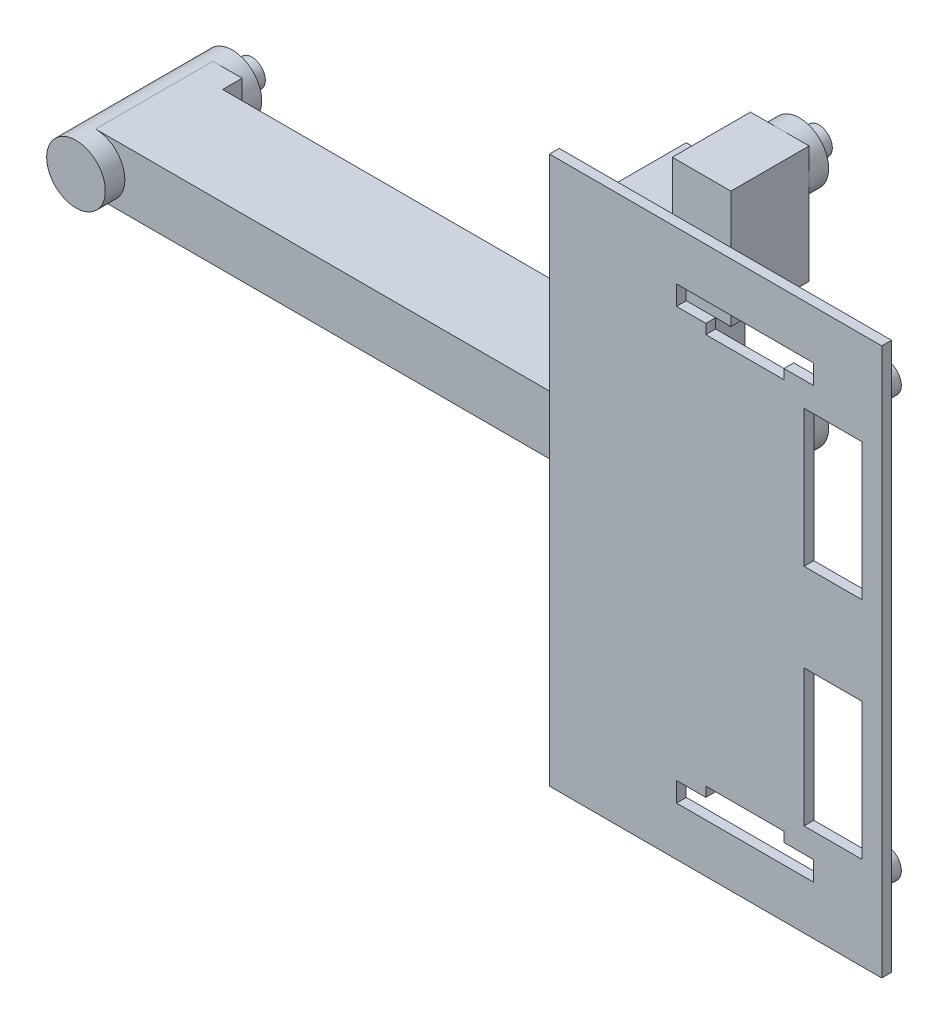
from build123d import *

# Parameters (mm, degrees)
SKETCH_1_W            = 65
SKETCH_1_H            = 6
EXTRUDE_1_DEPTH       = 12
FILLET_4_R            = 3
FILLET_5_R            = 3
SKETCH_7_R            = 1.375
EXTRUDE_2_DEPTH       = 4
SKETCH_8_R            = 3
EXTRUDE_3_DEPTH       = 2
EXTRUDE_START         = 4
SKETCH_9_R            = 3
EXTRUDE_4_DEPTH       = 4
SKETCH_10_R           = 3
EXTRUDE_5_DEPTH       = 2
SKETCH_11_R           = 1.375
EXTRUDE_6_DEPTH       = 2
SKETCH_12_W           = 6
SKETCH_12_H           = 6
EXTRUDE_7_DEPTH       = 2
SKETCH_13_W           = 6
SKETCH_13_H           = 30
EXTRUDE_8_DEPTH       = 2
SKETCH_14_R           = 3
EXTRUDE_9_DEPTH       = 2
SKETCH_15_R           = 1.375
EXTRUDE_10_DEPTH      = 4
SKETCH_18_W           = 6
SKETCH_18_H           = 30
EXTRUDE_11_DEPTH      = 4
SKETCH_19_W           = 6
SKETCH_19_H           = 30
EXTRUDE_12_DEPTH      = 10
SKETCH_29_W           = 68.740273107
SKETCH_29_H           = 36.698484322
CUT_EXTRUDE_3_DEPTH   = 2
SKETCH_30_W           = 7.57
SKETCH_30_H           = 6
CUT_EXTRUDE_4_DEPTH   = 12
SKETCH_31_W           = 7.57
SKETCH_31_H           = 24
EXTRUDE_18_DEPTH      = 2
SKETCH_32_W           = 6
SKETCH_32_H           = 18
CUT_EXTRUDE_6_DEPTH   = 2
SKETCH_33_W           = 1.57
SKETCH_33_H           = 18
CUT_EXTRUDE_7_DEPTH   = 2
SKETCH_34_W           = 34
SKETCH_34_H           = 50
EXTRUDE_19_DEPTH      = 1
SKETCH_35_R           = 1.5
EXTRUDE_20_DEPTH      = 2
SKETCH_36_W           = 18
SKETCH_36_H           = 4
CUT_EXTRUDE_8_DEPTH   = 3
SKETCH_37_W           = 18
SKETCH_37_H           = 4
CUT_EXTRUDE_9_DEPTH   = 3
SKETCH_38_W           = 7.949608938
SKETCH_38_H           = 37
CUT_EXTRUDE_10_DEPTH  = 3
SKETCH_39_W           = 2
SKETCH_39_H           = 38.777384981
EXTRUDE_21_DEPTH      = 1
SKETCH_40_W           = 19.891420203
SKETCH_40_H           = 2
EXTRUDE_22_DEPTH      = 1
SKETCH_41_W           = 18
SKETCH_41_H           = 2
EXTRUDE_23_DEPTH      = 1
SKETCH_42_W           = 5.949608938
SKETCH_42_H           = 7.78599904
EXTRUDE_24_DEPTH      = 1
SKETCH_43_W           = 2
SKETCH_43_H           = 2
EXTRUDE_25_DEPTH      = 1
SKETCH_44_W           = 34
SKETCH_44_H           = 6
EXTRUDE_26_DEPTH      = 1
SKETCH_45_W           = 5.949608938
SKETCH_45_H           = 1.150209715
SKETCH_45_H_2         = 0.063791245
EXTRUDE_27_DEPTH      = 1
SKETCH_46_W           = 7
SKETCH_46_H           = 1
CUT_EXTRUDE_11_DEPTH  = 11
SKETCH_47_W           = 5
SKETCH_47_H           = 6
EXTRUDE_28_DEPTH      = 7
SKETCH_48_W           = 7.57
SKETCH_48_H           = 6
EXTRUDE_29_DEPTH      = 2
SKETCH_50_W           = 26.677609113
SKETCH_50_H           = 51.423807613
EXTRUDE_35_DEPTH      = 1
SKETCH_53_W           = 28.548663147
SKETCH_53_H           = 51.906660266
CUT_EXTRUDE_21_DEPTH  = 2
SKETCH_52_R           = 1.5
EXTRUDE_37_DEPTH      = 2
SKETCH_49_W           = 5.949608938
SKETCH_49_H           = 14
CUT_EXTRUDE_22_DEPTH  = 4
SKETCH_55_W           = 2
SKETCH_55_H           = 29.414250284
EXTRUDE_40_DEPTH      = 4
SKETCH_58_W           = 25.591190643
SKETCH_58_H           = 50.94095496
CUT_EXTRUDE_23_DEPTH  = 4
SKETCH_57_R           = 1.5
EXTRUDE_41_DEPTH      = 2
SKETCH_60_W           = 26.134399878
SKETCH_60_H           = 52.268799757
EXTRUDE_43_DEPTH      = 1
SKETCH_59_W           = 5.949608938
SKETCH_59_H           = 14
CUT_EXTRUDE_24_DEPTH  = 1
SKETCH_64_W           = 54.796032673
SKETCH_64_H           = 10.19721688
CUT_EXTRUDE_25_DEPTH  = 43
SKETCH_62_R           = 3
EXTRUDE_44_DEPTH      = 2
SKETCH_63_R           = 3
EXTRUDE_45_DEPTH      = 2
SKETCH_65_R           = 1.375
EXTRUDE_46_DEPTH      = 2
SKETCH_66_W           = 1
SKETCH_66_H           = 30
CUT_EXTRUDE_26_DEPTH  = 5
SKETCH_68_W           = 6.57
SKETCH_68_H           = 9
EXTRUDE_47_DEPTH      = 12
SKETCH_67_W           = 6.57
SKETCH_67_H           = 6
CUT_EXTRUDE_29_DEPTH  = 13
SKETCH_70_W           = 48.43
SKETCH_70_H           = 12
EXTRUDE_48_DEPTH      = 7
SKETCH_71_W           = 6.57
SKETCH_71_H           = 4
EXTRUDE_49_DEPTH      = 1
SKETCH_74_R           = 3
CUT_EXTRUDE_30_DEPTH  = 32
SKETCH_75_W           = 3.133028802
SKETCH_75_H           = 7
EXTRUDE_51_DEPTH      = 12
SKETCH_76_W           = 8.590635634
SKETCH_76_H           = 9.113505167
CUT_EXTRUDE_31_DEPTH  = 12
SKETCH_77_W           = 13
SKETCH_77_H           = 1
CUT_EXTRUDE_32_DEPTH  = 124
SKETCH_72_R           = 3
EXTRUDE_52_DEPTH      = 2
EXTRUDE_53_DEPTH      = 2
EXTRUDE_53_DEPTH_BACK = 14
SKETCH_73_R           = 3
SKETCH_78_R           = 1.375
EXTRUDE_54_DEPTH      = 2
SKETCH_79_W           = 52
SKETCH_79_H           = 6
CUT_EXTRUDE_33_DEPTH  = 2
SKETCH_80_W           = 6.57
SKETCH_80_H           = 1
EXTRUDE_55_DEPTH      = 2
SKETCH_81_W           = 8
SKETCH_81_H           = 1
CUT_EXTRUDE_34_DEPTH  = 2
SKETCH_82_W           = 6.57
SKETCH_82_H           = 1
CUT_EXTRUDE_35_DEPTH  = 45
SKETCH_83_R           = 1.5
SKETCH_83_R_2         = 1.497866477
EXTRUDE_56_DEPTH      = 1
SKETCH_84_R           = 2.738772592
CUT_EXTRUDE_36_DEPTH  = 3
SKETCH_85_R           = 1.5
EXTRUDE_57_DEPTH      = 3


with BuildPart() as part:
    # 草图1 → 凸台-拉伸1 (new body)
    with BuildSketch(Plane.XY):
        Rectangle(SKETCH_1_W, SKETCH_1_H)
    extrude(amount=EXTRUDE_1_DEPTH)

    # 圆角4
    fillet_4_edges = [part.edges().sort_by_distance(p)[0] for p in [
        (-32.5, -3, 6),
    ]]
    fillet(fillet_4_edges, radius=FILLET_4_R)

    # 圆角5
    fillet_5_edges = [part.edges().sort_by_distance(p)[0] for p in [
        (-32.5, 3, 6),
    ]]
    fillet(fillet_5_edges, radius=FILLET_5_R - 0.0001)  # a hair under: the kernel refuses the full size

    # 草图7 → 凸台-拉伸2 (add)
    with BuildSketch(Plane(origin=(0, 0, 0), x_dir=(-1, 0, 0), z_dir=(0, 0, -1))):
        with Locations((29.5, 0)):
            Circle(SKETCH_7_R)
    extrude(amount=EXTRUDE_2_DEPTH)

    # 草图8 → 凸台-拉伸3 (add)
    with BuildSketch(Plane(origin=(0, 0, 0), x_dir=(-1, 0, 0), z_dir=(0, 0, -1))):
        with Locations((29.5, 0)):
            Circle(SKETCH_8_R)
    extrude(amount=EXTRUDE_3_DEPTH)

    # 草图9 → 凸台-拉伸4 (add)
    with BuildSketch(Plane.XY.offset(12).offset(EXTRUDE_START)):
        with Locations(Location((-29.5, 0, 0), (0, 0, 180))):
            Circle(SKETCH_9_R)
    extrude(amount=-EXTRUDE_4_DEPTH)

    # 草图10 → 凸台-拉伸5 (add)
    with BuildSketch(Plane(origin=(0, 0, 0), x_dir=(-1, 0, 0), z_dir=(0, 0, -1))):
        with Locations(Location((-29.5, 0, 0), (0, 0, 180))):
            Circle(SKETCH_10_R)
    extrude(amount=EXTRUDE_5_DEPTH)

    # 草图11 → 凸台-拉伸6 (add)
    with BuildSketch(Plane(origin=(0, 0, -2), x_dir=(-1, 0, 0), z_dir=(0, 0, -1))):
        with Locations((-29.5, 0)):
            Circle(SKETCH_11_R)
    extrude(amount=EXTRUDE_6_DEPTH)

    # 草图12 → 凸台-拉伸7 (add)
    with BuildSketch(Plane.XY.offset(12)):
        with Locations((29.5, 0)):
            Rectangle(SKETCH_12_W, SKETCH_12_H)
    extrude(amount=EXTRUDE_7_DEPTH)

    # 草图13 → 凸台-拉伸8 (add)
    with BuildSketch(Plane(origin=(0, 0, 0), x_dir=(-1, 0, 0), z_dir=(0, 0, -1))):
        with Locations((-29.5, 12)):
            Rectangle(SKETCH_13_W, SKETCH_13_H)
    extrude(amount=-EXTRUDE_8_DEPTH)

    # 草图14 → 凸台-拉伸9 (add)
    with BuildSketch(Plane(origin=(0, 0, 0), x_dir=(-1, 0, 0), z_dir=(0, 0, -1))):
        with Locations((-29.5, 24)):
            Circle(SKETCH_14_R)
    extrude(amount=EXTRUDE_9_DEPTH)

    # 草图15 → 凸台-拉伸10 (add)
    with BuildSketch(Plane(origin=(0, 0, 0), x_dir=(-1, 0, 0), z_dir=(0, 0, -1))):
        with Locations((-29.5, 24)):
            Circle(SKETCH_15_R)
    extrude(amount=EXTRUDE_10_DEPTH)

    # 草图18 → 凸台-拉伸11 (add)
    with BuildSketch(Plane.XY.offset(12)):
        with Locations((21.93, 12)):
            Rectangle(SKETCH_18_W, SKETCH_18_H)
    extrude(amount=EXTRUDE_11_DEPTH)

    # 草图19 → 凸台-拉伸12 (add)
    with BuildSketch(Plane(origin=(0, 0, 12), x_dir=(-1, 0, 0), z_dir=(0, 0, -1))):
        with Locations((-21.93, 12)):
            Rectangle(SKETCH_19_W, SKETCH_19_H)
    extrude(amount=EXTRUDE_12_DEPTH)

    # 草图29 → 切除-拉伸3 (cut)
    with BuildSketch(Plane.XY.offset(16)):
        with Locations((-9.440136553, 8.650757839)):
            Rectangle(SKETCH_29_W, SKETCH_29_H)
    extrude(amount=-CUT_EXTRUDE_3_DEPTH, mode=Mode.SUBTRACT)

    # 草图30 → 切除-拉伸4 (cut)
    with BuildSketch(Plane.XY.offset(14)):
        with Locations((28.715, 0)):
            Rectangle(SKETCH_30_W, SKETCH_30_H)
    extrude(amount=-CUT_EXTRUDE_4_DEPTH, mode=Mode.SUBTRACT)

    # 草图31 → 凸台-拉伸18 (add)
    with BuildSketch(Plane(origin=(0, 0, 2), x_dir=(-1, 0, 0), z_dir=(0, 0, -1))):
        with Locations((-22.715, 15)):
            Rectangle(SKETCH_31_W, SKETCH_31_H)
    extrude(amount=EXTRUDE_18_DEPTH)

    # 草图32 → 切除-拉伸6 (cut)
    with BuildSketch(Plane(origin=(0, 0, 0), x_dir=(-1, 0, 0), z_dir=(0, 0, -1))):
        with Locations((-29.5, 12)):
            Rectangle(SKETCH_32_W, SKETCH_32_H)
    extrude(amount=-CUT_EXTRUDE_6_DEPTH, mode=Mode.SUBTRACT)

    # 草图33 → 切除-拉伸7 (cut)
    with BuildSketch(Plane.XY.offset(2)):
        with Locations((25.715, 12)):
            Rectangle(SKETCH_33_W, SKETCH_33_H)
    extrude(amount=-CUT_EXTRUDE_7_DEPTH, mode=Mode.SUBTRACT)

    # 草图34 → 凸台-拉伸19 (add)
    with BuildSketch(Plane.XY.offset(14)):
        with Locations((35.93, 2)):
            Rectangle(SKETCH_34_W, SKETCH_34_H)
    extrude(amount=-EXTRUDE_19_DEPTH)

    # 草图35 → 凸台-拉伸20 (add)
    with BuildSketch(Plane(origin=(0, 0, 13), x_dir=(-1, 0, 0), z_dir=(0, 0, -1))):
        with Locations(Location((-49.43, 23.5, 0), (0, 0, 180))):
            Circle(SKETCH_35_R)
        with Locations(Location((-49.43, -19.5, 0), (0, 0, 180))):
            Circle(SKETCH_35_R)
        with Locations(Location((-28.43, -19.5, 0), (0, 0, 180))):
            Circle(SKETCH_35_R)
        with Locations(Location((-28.43, 23.5, 0), (0, 0, 180))):
            Circle(SKETCH_35_R)
    extrude(amount=EXTRUDE_20_DEPTH)

    # 草图36 → 切除-拉伸8 (cut)
    with BuildSketch(Plane(origin=(0, 0, 13), x_dir=(-1, 0, 0), z_dir=(0, 0, -1))):
        with Locations((-38.93, 25)):
            Rectangle(SKETCH_36_W, SKETCH_36_H)
    extrude(amount=-CUT_EXTRUDE_8_DEPTH, mode=Mode.SUBTRACT)

    # 草图37 → 切除-拉伸9 (cut)
    with BuildSketch(Plane(origin=(0, 0, 13), x_dir=(-1, 0, 0), z_dir=(0, 0, -1))):
        with Locations((-38.93, -21)):
            Rectangle(SKETCH_37_W, SKETCH_37_H)
    extrude(amount=-CUT_EXTRUDE_9_DEPTH, mode=Mode.SUBTRACT)

    # 草图38 → 切除-拉伸10 (cut)
    with BuildSketch(Plane(origin=(0, 0, 13), x_dir=(-1, 0, 0), z_dir=(0, 0, -1))):
        with Locations((-48.955195531, 2)):
            Rectangle(SKETCH_38_W, SKETCH_38_H)
    extrude(amount=-CUT_EXTRUDE_10_DEPTH, mode=Mode.SUBTRACT)

    # 草图39 → 凸台-拉伸21 (add)
    with BuildSketch(Plane(origin=(0, 0, 13), x_dir=(-1, 0, 0), z_dir=(0, 0, -1))):
        with Locations((-51.93, 1.111307509)):
            Rectangle(SKETCH_39_W, SKETCH_39_H)
    extrude(amount=-EXTRUDE_21_DEPTH)

    # 草图40 → 凸台-拉伸22 (add)
    with BuildSketch(Plane(origin=(0, 0, 13), x_dir=(-1, 0, 0), z_dir=(0, 0, -1))):
        with Locations((-37.984289899, 26)):
            Rectangle(SKETCH_40_W, SKETCH_40_H)
    extrude(amount=-EXTRUDE_22_DEPTH)

    # 草图41 → 凸台-拉伸23 (add)
    with BuildSketch(Plane(origin=(0, 0, 13), x_dir=(-1, 0, 0), z_dir=(0, 0, -1))):
        with Locations((-38.93, -22)):
            Rectangle(SKETCH_41_W, SKETCH_41_H)
    extrude(amount=-EXTRUDE_23_DEPTH)

    # 草图42 → 凸台-拉伸24 (add)
    with BuildSketch(Plane(origin=(0, 0, 13), x_dir=(-1, 0, 0), z_dir=(0, 0, -1))):
        with Locations((-47.955195531, 1.456790765)):
            Rectangle(SKETCH_42_W, SKETCH_42_H)
    extrude(amount=-EXTRUDE_24_DEPTH)

    # 草图43 → 凸台-拉伸25 (add)
    with BuildSketch(Plane(origin=(0, 0, 13), x_dir=(-1, 0, 0), z_dir=(0, 0, -1))):
        with Locations((-46.93, -20)):
            Rectangle(SKETCH_43_W, SKETCH_43_H)
        with Locations((-30.93, -20)):
            Rectangle(SKETCH_43_W, SKETCH_43_H)
        with Locations((-46.93, 24)):
            Rectangle(SKETCH_43_W, SKETCH_43_H)
        with Locations((-30.93, 24)):
            Rectangle(SKETCH_43_W, SKETCH_43_H)
    extrude(amount=-EXTRUDE_25_DEPTH)

    # 草图44 → 凸台-拉伸26 (add)
    with BuildSketch(Plane(origin=(0, 0, 13), x_dir=(-1, 0, 0), z_dir=(0, 0, -1))):
        with Locations((-35.93, -26)):
            Rectangle(SKETCH_44_W, SKETCH_44_H)
    extrude(amount=-EXTRUDE_26_DEPTH)

    # 草图45 → 凸台-拉伸27 (add)
    with BuildSketch(Plane.XY.offset(14)):
        with Locations((47.955195531, 5.924895143)):
            Rectangle(SKETCH_45_W, SKETCH_45_H)
        with Locations((47.955195531, -2.468104378)):
            Rectangle(SKETCH_45_W, SKETCH_45_H_2)
    extrude(amount=-EXTRUDE_27_DEPTH)

    # 草图46 → 切除-拉伸11 (cut)
    with BuildSketch(Plane.XY.offset(14)):
        with Locations((38.93, 22.5)):
            Rectangle(SKETCH_46_W, SKETCH_46_H)
        with Locations((38.93, -18.5)):
            Rectangle(SKETCH_46_W, SKETCH_46_H)
    extrude(amount=-CUT_EXTRUDE_11_DEPTH, mode=Mode.SUBTRACT)

    # 草图47 → 凸台-拉伸28 (add)
    with BuildSketch(Plane.XY.offset(2)):
        with Locations((27.43, 24)):
            Rectangle(SKETCH_47_W, SKETCH_47_H)
    extrude(amount=EXTRUDE_28_DEPTH)

    # 草图48 → 凸台-拉伸29 (add)
    with BuildSketch(Plane.XY.offset(2)):
        with Locations((28.715, 0)):
            Rectangle(SKETCH_48_W, SKETCH_48_H)
    extrude(amount=EXTRUDE_29_DEPTH)

    # 草图50 → 凸台-拉伸35 (add)
    with BuildSketch(Plane(origin=(0, 0, 13), x_dir=(-1, 0, 0), z_dir=(0, 0, -1))):
        with Locations((-38.341167074, 0.599449416)):
            Rectangle(SKETCH_50_W, SKETCH_50_H)
    extrude(amount=-EXTRUDE_35_DEPTH)

    # 草图53 → 切除-拉伸21 (cut)
    with BuildSketch(Plane(origin=(0, 0, 13), x_dir=(-1, 0, 0), z_dir=(0, 0, -1))):
        with Locations((-37.767779549, -0.124829565)):
            Rectangle(SKETCH_53_W, SKETCH_53_H)
    extrude(amount=CUT_EXTRUDE_21_DEPTH, mode=Mode.SUBTRACT)

    # 草图52 → 凸台-拉伸37 (add)
    with BuildSketch(Plane(origin=(0, 0, 13), x_dir=(-1, 0, 0), z_dir=(0, 0, -1))):
        with Locations(Location((-49.43, 19.5, 0), (0, 0, 180))):
            Circle(SKETCH_52_R)
        with Locations(Location((-28.43, 19.5, 0), (0, 0, 180))):
            Circle(SKETCH_52_R)
        with Locations(Location((-49.43, -23.5, 0), (0, 0, 180))):
            Circle(SKETCH_52_R)
        with Locations(Location((-28.43, -23.5, 0), (0, 0, 180))):
            Circle(SKETCH_52_R)
    extrude(amount=EXTRUDE_37_DEPTH)

    # 草图49 → 切除-拉伸22 (cut)
    with BuildSketch(Plane(origin=(0, 0, 13), x_dir=(-1, 0, 0), z_dir=(0, 0, -1))):
        Polygon((-45.93, -23), (-45.93, -25), (-31.93, -25), (-31.93, -23), (-35.43, -23), (-35.43, -22), (-42.43, -22), (-42.43, -23), align=None)
        Polygon((-45.93, 19), (-42.43, 19), (-42.43, 18), (-35.43, 18), (-35.43, 19), (-31.93, 19), (-31.93, 21), (-45.93, 21), align=None)
        with Locations((-47.955195531, -13.5)):
            Rectangle(SKETCH_49_W, SKETCH_49_H)
        with Locations((-47.955195531, 9.5)):
            Rectangle(SKETCH_49_W, SKETCH_49_H)
    extrude(amount=-CUT_EXTRUDE_22_DEPTH, mode=Mode.SUBTRACT)

    # 草图55 → 凸台-拉伸40 (add)
    with BuildSketch(Plane(origin=(24.93, 0, 0), x_dir=(0, 0, -1), z_dir=(1, 0, 0))):
        with Locations((-12, 11.707125142)):
            Rectangle(SKETCH_55_W, SKETCH_55_H)
    extrude(amount=-EXTRUDE_40_DEPTH)

    # 草图58 → 切除-拉伸23 (cut)
    with BuildSketch(Plane(origin=(0, 0, 13), x_dir=(-1, 0, 0), z_dir=(0, 0, -1))):
        with Locations((-38.582593401, -2.840875742)):
            Rectangle(SKETCH_58_W, SKETCH_58_H)
    extrude(amount=CUT_EXTRUDE_23_DEPTH, mode=Mode.SUBTRACT)

    # 草图57 → 凸台-拉伸41 (add)
    with BuildSketch(Plane(origin=(0, 0, 13), x_dir=(-1, 0, 0), z_dir=(0, 0, -1))):
        with Locations(Location((-49.434447137, 20.499990111, 0), (0, 0, 180))):
            Circle(SKETCH_57_R)
        with Locations(Location((-28.434447137, 20.499990111, 0), (0, 0, 180))):
            Circle(SKETCH_57_R)
        with Locations(Location((-28.432313614, -22.500002676, 0), (0, 0, 180))):
            Circle(SKETCH_57_R)
        with Locations(Location((-49.434447137, -22.500002676, 0), (0, 0, 180))):
            Circle(SKETCH_57_R)
    extrude(amount=EXTRUDE_41_DEPTH)

    # 草图60 → 凸台-拉伸43 (add)
    with BuildSketch(Plane(origin=(0, 0, 13), x_dir=(-1, 0, 0), z_dir=(0, 0, -1))):
        with Locations((-39.337050673, -0.849108546)):
            Rectangle(SKETCH_60_W, SKETCH_60_H)
    extrude(amount=-EXTRUDE_43_DEPTH)

    # 草图59 → 切除-拉伸24 (cut)
    with BuildSketch(Plane(origin=(0, 0, 13), x_dir=(-1, 0, 0), z_dir=(0, 0, -1))):
        with Locations((-47.955195531, -12.5)):
            Rectangle(SKETCH_59_W, SKETCH_59_H)
        with Locations((-47.955195531, 10.5)):
            Rectangle(SKETCH_59_W, SKETCH_59_H)
        Polygon((-45.93, 22), (-45.93, 20), (-42.43, 20), (-42.43, 19), (-35.43, 19), (-35.43, 20), (-31.93, 20), (-31.93, 22), align=None)
        Polygon((-45.93, -24), (-31.93, -24), (-31.93, -22), (-35.43, -22), (-35.43, -21), (-42.43, -21), (-42.43, -22), (-45.93, -22), align=None)
    extrude(amount=-CUT_EXTRUDE_24_DEPTH, mode=Mode.SUBTRACT)

    # 草图64 → 切除-拉伸25 (cut)
    with BuildSketch(Plane.XZ.offset(3)):
        with Locations((5.101983663, -5.09860844)):
            Rectangle(SKETCH_64_W, SKETCH_64_H)
    extrude(amount=-CUT_EXTRUDE_25_DEPTH, mode=Mode.SUBTRACT)

    # 草图62 → 凸台-拉伸44 (add)
    with BuildSketch(Plane(origin=(0, 0, 0), x_dir=(-1, 0, 0), z_dir=(0, 0, -1))):
        with Locations(Location((-28.5, 0, 0), (0, 0, 270))):
            Circle(SKETCH_62_R)
    extrude(amount=EXTRUDE_44_DEPTH)

    # 草图63 → 凸台-拉伸45 (add)
    with BuildSketch(Plane(origin=(0, 0, 0), x_dir=(-1, 0, 0), z_dir=(0, 0, -1))):
        with Locations(Location((-28.5, 24, 0), (0, 0, 270))):
            Circle(SKETCH_63_R)
    extrude(amount=EXTRUDE_45_DEPTH)

    # 草图65 → 凸台-拉伸46 (add)
    with BuildSketch(Plane(origin=(0, 0, -2), x_dir=(-1, 0, 0), z_dir=(0, 0, -1))):
        with Locations((-28.5, 24)):
            Circle(SKETCH_65_R)
        with Locations((-28.5, 0)):
            Circle(SKETCH_65_R)
    extrude(amount=EXTRUDE_46_DEPTH)

    # 草图66 → 切除-拉伸26 (cut)
    with BuildSketch(Plane(origin=(0, 0, 0), x_dir=(-1, 0, 0), z_dir=(0, 0, -1))):
        with Locations((-32, 12)):
            Rectangle(SKETCH_66_W, SKETCH_66_H)
    extrude(amount=-CUT_EXTRUDE_26_DEPTH, mode=Mode.SUBTRACT)

    # 草图68 → 凸台-拉伸47 (add)
    with BuildSketch(Plane(origin=(0, 27, 0), x_dir=(1, 0, 0), z_dir=(0, 1, 0))):
        with Locations((28.215, -4.5)):
            Rectangle(SKETCH_68_W, SKETCH_68_H)
    extrude(amount=-EXTRUDE_47_DEPTH)

    # 草图67 → 切除-拉伸29 (cut)
    with BuildSketch(Plane(origin=(0, 0, 0), x_dir=(-1, 0, 0), z_dir=(0, 0, -1))):
        with Locations((-22.215, 24)):
            Rectangle(SKETCH_67_W, SKETCH_67_H)
    extrude(amount=-CUT_EXTRUDE_29_DEPTH, mode=Mode.SUBTRACT)

    # 草图70 → 凸台-拉伸48 (add)
    with BuildSketch(Plane.XZ.offset(3)):
        Polygon((24.93, 4), (24.93, 13), (18.93, 13), (18.93, 12), (18.93, 0), (24.93, 0), align=None)
        with Locations((-5.285, 6)):
            Rectangle(SKETCH_70_W, SKETCH_70_H)
    extrude(amount=-EXTRUDE_48_DEPTH)

    # 草图71 → 凸台-拉伸49 (add)
    with BuildSketch(Plane(origin=(0, 3, 0), x_dir=(1, 0, 0), z_dir=(0, 1, 0))):
        with Locations((28.215, -2)):
            Rectangle(SKETCH_71_W, SKETCH_71_H)
    extrude(amount=EXTRUDE_49_DEPTH)

    # 草图74 → 切除-拉伸30 (cut)
    with BuildSketch(Plane.XY.offset(14)):
        with Locations((-29.5, 0)):
            Circle(SKETCH_74_R)
    extrude(amount=-CUT_EXTRUDE_30_DEPTH, mode=Mode.SUBTRACT)


with BuildPart() as cut_extrude_30_kept_piece:
    # of the separate pieces the step leaves, the one the design keeps (cut_extrude_30_pieces_kept)
    add(part.part.solids().sort_by_distance((28.5, -3, 0))[0])

    # 草图75 → 凸台-拉伸51 (add)
    with BuildSketch(Plane(origin=(0, 0, 0), x_dir=(-1, 0, 0), z_dir=(0, 0, -1))):
        with Locations((27.933485599, 0.5)):
            Rectangle(SKETCH_75_W, SKETCH_75_H)
    extrude(amount=-EXTRUDE_51_DEPTH)

    # 草图76 → 切除-拉伸31 (cut)
    with BuildSketch(Plane(origin=(31.5, 0, 0), x_dir=(0, 0, -1), z_dir=(1, 0, 0))):
        with Locations((4.295317817, -0.556752584)):
            Rectangle(SKETCH_76_W, SKETCH_76_H)
    extrude(amount=-CUT_EXTRUDE_31_DEPTH, mode=Mode.SUBTRACT)

    # 草图77 → 切除-拉伸32 (cut)
    with BuildSketch(Plane(origin=(31.5, 0, 0), x_dir=(0, 0, -1), z_dir=(1, 0, 0))):
        with Locations((-6.5, -2.5)):
            Rectangle(SKETCH_77_W, SKETCH_77_H)
    extrude(amount=-CUT_EXTRUDE_32_DEPTH, mode=Mode.SUBTRACT)

    # 草图72 → 凸台-拉伸52 (add)
    with BuildSketch(Plane(origin=(0, 0, 0), x_dir=(-1, 0, 0), z_dir=(0, 0, -1))):
        with Locations(Location((-28.5, 1, 0), (0, 0, 180))):
            Circle(SKETCH_72_R)
    extrude(amount=EXTRUDE_52_DEPTH)

    # 草图73 → 凸台-拉伸53 (add, two sides: drawn at the far end of the back side and taken through both)
    with BuildSketch(Plane(origin=(0, 0, 0), x_dir=(-1, 0, 0), z_dir=(0, 0, -1)).offset(-EXTRUDE_53_DEPTH_BACK)):
        with Locations((29.5, 1)):
            Circle(SKETCH_73_R)
    extrude(amount=EXTRUDE_53_DEPTH + EXTRUDE_53_DEPTH_BACK)

    # 草图78 → 凸台-拉伸54 (add)
    with BuildSketch(Plane(origin=(0, 0, -2), x_dir=(-1, 0, 0), z_dir=(0, 0, -1))):
        with Locations((-28.5, 1)):
            Circle(SKETCH_78_R)
        with Locations((29.5, 1)):
            Circle(SKETCH_78_R)
    extrude(amount=EXTRUDE_54_DEPTH)

    # 草图79 → 切除-拉伸33 (cut)
    with BuildSketch(Plane(origin=(0, 0, 0), x_dir=(-1, 0, 0), z_dir=(0, 0, -1))):
        with Locations((0.5, 1)):
            Rectangle(SKETCH_79_W, SKETCH_79_H)
    extrude(amount=-CUT_EXTRUDE_33_DEPTH, mode=Mode.SUBTRACT)

    # 草图80 → 凸台-拉伸55 (add)
    with BuildSketch(Plane(origin=(0, 0, 2), x_dir=(-1, 0, 0), z_dir=(0, 0, -1))):
        with Locations((-22.215, 3.5)):
            Rectangle(SKETCH_80_W, SKETCH_80_H)
    extrude(amount=EXTRUDE_55_DEPTH)

    # 草图81 → 切除-拉伸34 (cut)
    with BuildSketch(Plane(origin=(0, 0, 13), x_dir=(-1, 0, 0), z_dir=(0, 0, -1))):
        with Locations((-38.93, -21.5)):
            Rectangle(SKETCH_81_W, SKETCH_81_H)
        with Locations((-38.93, 19.5)):
            Rectangle(SKETCH_81_W, SKETCH_81_H)
    extrude(amount=-CUT_EXTRUDE_34_DEPTH, mode=Mode.SUBTRACT)

    # 草图82 → 切除-拉伸35 (cut)
    with BuildSketch(Plane(origin=(0, 27, 0), x_dir=(1, 0, 0), z_dir=(0, 1, 0))):
        with Locations((28.215, -8.5)):
            Rectangle(SKETCH_82_W, SKETCH_82_H)
    extrude(amount=-CUT_EXTRUDE_35_DEPTH, mode=Mode.SUBTRACT)

    # 草图83 → 凸台-拉伸56 (add)
    with BuildSketch(Plane(origin=(0, 0, 11), x_dir=(-1, 0, 0), z_dir=(0, 0, -1))):
        with Locations(Location((-49.434447137, 20.499990111, 0), (0, 0, 180))):
            Circle(SKETCH_83_R)
        with Locations(Location((-49.434447137, -22.500002676, 0), (0, 0, 180))):
            Circle(SKETCH_83_R)
        with Locations(Location((-28.432313614, -22.500002676, 0), (0, 0, 180))):
            Circle(SKETCH_83_R)
        with Locations((-28.432313614, 20.499990111)):
            Circle(SKETCH_83_R_2)
    extrude(amount=EXTRUDE_56_DEPTH)

    # 草图84 → 切除-拉伸36 (cut)
    with BuildSketch(Plane(origin=(0, 0, 10), x_dir=(-1, 0, 0), z_dir=(0, 0, -1))):
        with Locations((-28.17934676, 20.387325453)):
            Circle(SKETCH_84_R)
    extrude(amount=-CUT_EXTRUDE_36_DEPTH, mode=Mode.SUBTRACT)

    # 草图85 → 凸台-拉伸57 (add)
    with BuildSketch(Plane(origin=(0, 0, 13), x_dir=(-1, 0, 0), z_dir=(0, 0, -1))):
        with Locations(Location((-28.434447137, 20.499997271, 0), (0, 0, 180))):
            Circle(SKETCH_85_R)
    extrude(amount=EXTRUDE_57_DEPTH)


solid = cut_extrude_30_kept_piece.part
